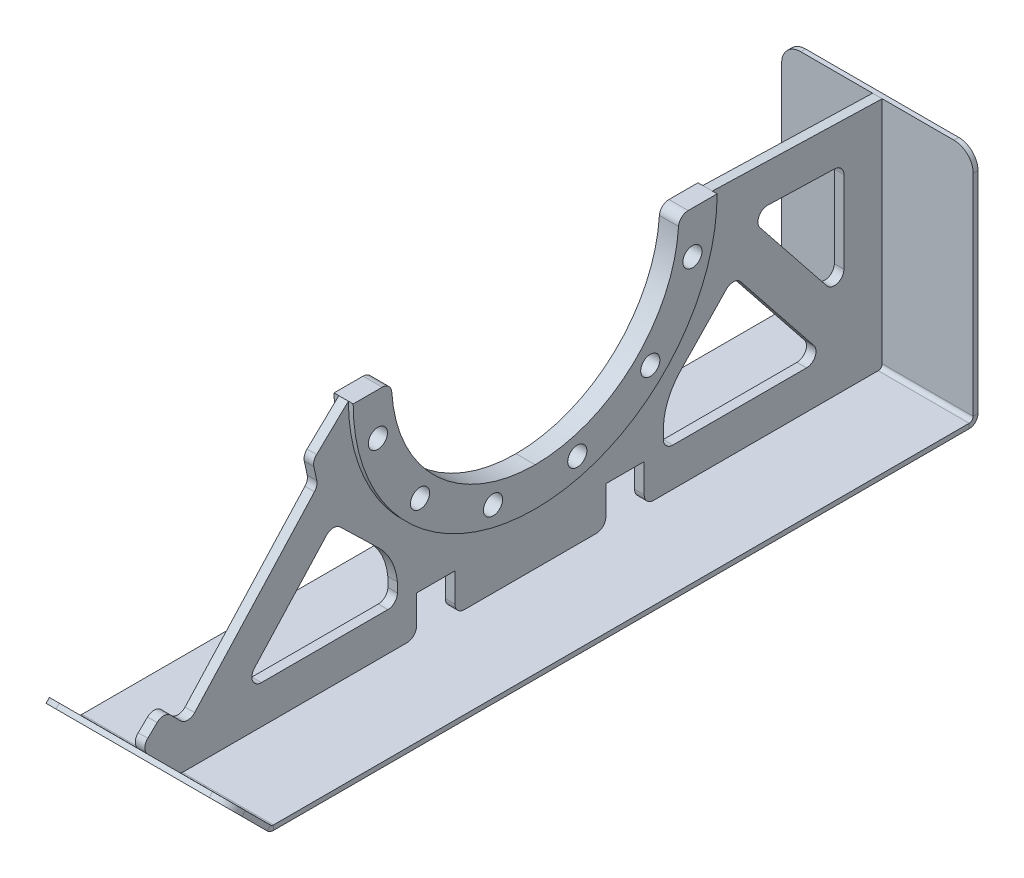
from build123d import *

# Parameters (mm, degrees)
FLANGE_PROFILE_DEPTH              = 12.7
F_7_8_1_DIAMETER_HOLE1_D          = 25.4
BOLT_PATTERN_COUNT                = 12
SKETCH5_W                         = 254
SKETCH5_H                         = 1317.865260112
BASE_SKID_DEPTH                   = 6.35
BEND_START                        = -127
BEND_HEEL_DEPTH                   = 254
BEND_HEEL_2_DEPTH                 = 254
BEND_TOE_DEPTH                    = 254
BEND_TOE_2_DEPTH                  = 254
WEBBING_BODY_DEPTH                = 6.35
WEBBING_HOLES_DEPTH               = 623.746559258
WEBBING_HOLES_DEPTH_BACK          = 623.746559258
CROSSBEAM_DEPTH                   = 623.746559258
CROSSBEAM_DEPTH_BACK              = 623.746559258
CROSSMEMBER_W                     = 50.8
CROSSMEMBER_H                     = 50.8
CROSSBEAM_CLEARANCE_DEPTH         = 6.35
CROSSBEAM_FILLET_R                = 12.7
FILLET_CLEARANCE_R                = 82.7
WEBBING_FILLET_R                  = 12.7
SKID_START                        = -474
SKID_EDGES_DEPTH                  = 8
SKID_START_2                      = -335
SKID_EDGES_2_DEPTH                = 8
FLANGE_FILLET_R                   = 12.7
CONVERT_START                     = -12.7
CONVERT_FLANGE_TO_SHEET_OUTLINE_R = 12.7
CONVERT_FLANGE_TO_SHEET_DEPTH     = 25.4
CONVERT_START_2                   = -6.35
CONVERT_WEBBING_TO_SHEET_DEPTH    = 12.7
FILLET2_R                         = 12.7


with BuildPart() as part:
    # Sketch1 → Flange Profile (new, symmetric)
    with BuildSketch(Plane(origin=(0, 0, 0), x_dir=(0, 0, -1), z_dir=(1, 0, 0))):
        with BuildLine():
            Line((241.3, 316.3), (190.5, 316.3))
            ThreePointArc((190.5, 316.3), (0, 125.8), (-190.5, 316.3))
            Line((-190.5, 316.3), (-241.3, 316.3))
            ThreePointArc((-241.3, 316.3), (0, 75), (241.3, 316.3))
        make_face()
    extrude(amount=FLANGE_PROFILE_DEPTH, both=True)

    # 7/8 (1) Diameter Hole1 (through all)
    with Locations(Plane(origin=(12.7, 260.420968162, -208.543385896), x_dir=(0, 0, 1), z_dir=(1, 0, 0))):
        with Locations((0, 0)):
            f_7_8_1_diameter_hole1 = Hole(F_7_8_1_DIAMETER_HOLE1_D / 2)

    # Bolt Pattern: 7/8 (1) Diameter Hole1 ×12 about axis
    bolt_pattern_axis = Axis((0, 316.3, 0), (1, 0, 0))
    for i in range(1, BOLT_PATTERN_COUNT):
        add(f_7_8_1_diameter_hole1.rotate(bolt_pattern_axis, i * 360 / BOLT_PATTERN_COUNT), mode=Mode.SUBTRACT)

    # Flange Fillet
    flange_fillet_edges = [part.edges().sort_by_distance(p)[0] for p in [
        (0, 316.3, 190.5),
        (0, 316.3, -190.5),
    ]]
    fillet(flange_fillet_edges, radius=FLANGE_FILLET_R)


with BuildPart() as body_2:
    # Base Skid: sheet metal written as solids
    # Sketch5 → Base Skid (new body)
    with BuildSketch(Plane(origin=(0, 0, 0), x_dir=(1, 0, 0), z_dir=(0, 1, 0))):
        with Locations((0, 118.6125)):
            Rectangle(SKETCH5_W, SKETCH5_H)
    extrude(amount=-BASE_SKID_DEPTH)

    # Bend Heel: read off the stored shape, not the designer's step
    # Bend Heel outline → Bend Heel (cut)
    with BuildSketch(Plane.YZ.offset(BEND_START)):
        with BuildLine():
            Line((0, -777.545130056), (0, -471.640528076))
            ThreePointArc((0, -471.640528076), (-4.636915504, -467.33583609), (-6.35, -461.245130056))
            Line((-6.35, -461.245130056), (-6.35, -777.545130056))
            Line((-6.35, -777.545130056), (0, -777.545130056))
        make_face()
    extrude(amount=BEND_HEEL_DEPTH, mode=Mode.SUBTRACT)

    # Bend Heel 2 outline → Bend Heel 2 (add)
    with BuildSketch(Plane.YZ.offset(BEND_START)):
        with BuildLine():
            Line((5.334, -472.929130056), (309.66453199, -472.929130056))
            Line((309.66453199, -472.929130056), (309.66453199, -466.579130056))
            Line((309.66453199, -466.579130056), (5.334, -466.579130056))
            ThreePointArc((5.334, -466.579130056), (1.56229243, -465.016837626), (0, -461.245130056))
            Line((0, -461.245130056), (0, -471.640528076))
            ThreePointArc((0, -471.640528076), (2.590277571, -472.602411563), (5.334, -472.929130056))
        make_face()
    extrude(amount=BEND_HEEL_2_DEPTH)

    # Bend Toe: read off the stored shape, not the designer's step
    # Bend Toe outline → Bend Toe (cut)
    with BuildSketch(Plane.YZ.offset(BEND_START)):
        with BuildLine():
            Line((-6.35, 540.320130056), (-6.35, 461.245130056))
            ThreePointArc((-6.35, 461.245130056), (-5.460608458, 465.71640328), (-2.927835631, 469.506965687))
            Line((-2.927835631, 469.506965687), (0, 472.434801318))
            Line((0, 472.434801318), (0, 540.320130056))
            Line((0, 540.320130056), (-6.35, 540.320130056))
        make_face()
    extrude(amount=BEND_TOE_DEPTH, mode=Mode.SUBTRACT)

    # Bend Toe 2 outline → Bend Toe 2 (add)
    with BuildSketch(Plane.YZ.offset(BEND_START)):
        with BuildLine():
            Line((48.754787092, 521.189588411), (0, 472.434801318))
            Line((0, 472.434801318), (0, 461.245130056))
            ThreePointArc((0, 461.245130056), (0.406026574, 463.286363484), (1.562292429, 465.016837626))
            Line((1.562292429, 465.016837626), (53.244915153, 516.69946035))
            Line((53.244915153, 516.69946035), (48.754787092, 521.189588411))
        make_face()
    extrude(amount=BEND_TOE_2_DEPTH)

    # Skid Edges: read off the stored shape, not the designer's step
    # Skid Edges outline → Skid Edges (cut)
    with BuildSketch(Plane.XY.offset(SKID_START)):
        with BuildLine():
            ThreePointArc((-127, 284.26453199), (-119.560512242, 302.225044232), (-101.6, 309.66453199))
            Line((-101.6, 309.66453199), (-127, 309.66453199))
            Line((-127, 309.66453199), (-127, 284.26453199))
        make_face()
        with BuildLine():
            ThreePointArc((101.6, 309.66453199), (119.560512242, 302.225044232), (127, 284.26453199))
            Line((127, 284.26453199), (127, 309.66453199))
            Line((127, 309.66453199), (101.6, 309.66453199))
        make_face()
    extrude(amount=SKID_EDGES_DEPTH, mode=Mode.SUBTRACT)

    # Skid Edges 2 outline → Skid Edges 2 (cut)
    with BuildSketch(Plane(origin=(0, 0, 0), x_dir=(1, 0, 0), z_dir=(0, 0.707106781186546, -0.707106781186549)).offset(SKID_START_2)):
        with BuildLine():
            Line((-127, -403.011532817), (-101.6, -403.011532817))
            ThreePointArc((-101.6, -403.011532817), (-119.560512242, -395.572045059), (-127, -377.611532817))
            Line((-127, -377.611532817), (-127, -403.011532817))
        make_face()
        with BuildLine():
            ThreePointArc((127, -377.611532817), (119.560512242, -395.572045059), (101.6, -403.011532817))
            Line((101.6, -403.011532817), (127, -403.011532817))
            Line((127, -403.011532817), (127, -377.611532817))
        make_face()
    extrude(amount=SKID_EDGES_2_DEPTH, mode=Mode.SUBTRACT)


with BuildPart() as body_3:
    # Sketch12 → Webbing Body (new, symmetric)
    with BuildSketch(Plane(origin=(0, 0, 0), x_dir=(0, 0, -1), z_dir=(1, 0, 0))):
        with BuildLine():
            Line((-516.69946035, 53.244915153), (-465.016837626, 1.562292429))
            ThreePointArc((-465.016837626, 1.562292429), (-463.286363484, 0.406026574), (-461.245130056, 0))
            Line((-461.245130056, 0), (461.245130056, 0))
            ThreePointArc((461.245130056, 0), (465.016837626, 1.562292429), (466.579130056, 5.334))
            Line((466.579130056, 5.334), (466.579130056, 309.66453199))
            Line((466.579130056, 309.66453199), (241.3, 316.3))
            ThreePointArc((241.3, 316.3), (0, 75), (-241.3, 316.3))
            Line((-241.3, 316.3), (-516.69946035, 53.244915153))
        make_face()
    extrude(amount=WEBBING_BODY_DEPTH, both=True)

    # Sketch13 → Webbing Holes (cut, two sides: drawn at the far end of the back side and taken through both)
    with BuildSketch(Plane(origin=(0, 0, 0), x_dir=(0, 0, -1), z_dir=(1, 0, 0)).offset(-WEBBING_HOLES_DEPTH_BACK)):
        Polygon((415.779130056, 260.338785622), (287.40157486, 264.120073132), (415.779130056, 103.103449381), align=None)
        Polygon((-121.787355666, 50.8), (-385.355758001, 50.8), (-261.612051176, 186.371001392), align=None)
        Polygon((269.894826504, 204.589693285), (392.510394874, 50.8), (121.787355666, 50.8), align=None)
        Polygon((-454.135463722, 50.8), (-485.950787611, 82.615323889), (-288.586784033, 271.132776469), (-281.840137894, 239.563133553), align=None)
    extrude(amount=WEBBING_HOLES_DEPTH + WEBBING_HOLES_DEPTH_BACK, mode=Mode.SUBTRACT)

    # crossmember → Crossbeam (cut, two sides: drawn at the far end of the back side and taken through both)
    with BuildSketch(Plane(origin=(0, 0, 0), x_dir=(0, 0, -1), z_dir=(1, 0, 0)).offset(-CROSSBEAM_DEPTH_BACK)):
        with Locations((125.5, 25.4)):
            Rectangle(CROSSMEMBER_W, CROSSMEMBER_H)
        with Locations((-125.5, 25.4)):
            Rectangle(CROSSMEMBER_W, CROSSMEMBER_H)
    extrude(amount=CROSSBEAM_DEPTH + CROSSBEAM_DEPTH_BACK, mode=Mode.SUBTRACT)

    # crossmember<5> → Crossbeam Clearance (add, symmetric)
    with BuildSketch(Plane(origin=(0, 0, 0), x_dir=(0, 0, -1), z_dir=(1, 0, 0))):
        Polygon((100.1, 50.8), (150.9, 50.8), (150.9, 0), (176.3, 0), (176.3, 76.2), (74.7, 76.2), (74.7, 0), (100.1, 0), align=None)
        Polygon((-100.1, 0), (-74.7, 0), (-74.7, 76.2), (-176.3, 76.2), (-176.3, 0), (-150.9, 0), (-150.9, 50.8), (-100.1, 50.8), align=None)
    extrude(amount=CROSSBEAM_CLEARANCE_DEPTH, both=True)

    # Crossbeam fillet
    crossbeam_fillet_edges = [body_3.edges().sort_by_distance(p)[0] for p in [
        (0, 0, -150.9),
        (0, 0, -100.1),
        (0, 0, 100.1),
        (0, 0, 150.9),
    ]]
    fillet(crossbeam_fillet_edges, radius=CROSSBEAM_FILLET_R)

    # Fillet Clearance
    # the kernel refuses this fillet: 82.7 mm, written as the material it adds along each edge
    with BuildSketch(Plane(origin=(6.35, 76.2, -146.248876324), x_dir=(0, 0, -1), z_dir=(-1, 0, 0))) as fillet_clearance_piece_1:
        with BuildLine():
            CenterArc((112.722573697, 2.172867127), FILLET_CLEARANCE_R, 181.505567644, 42.416154829)
            Line((53.154741922, -55.194052066), (0, 0))
            Line((0, 0), (30.051123676, 0))
        make_face()
    extrude(amount=12.7)
    with BuildSketch(Plane(origin=(-6.35, 76.2, 147.984309509), x_dir=(0, 0.6961019539421004, 0.7179429432190206), z_dir=(1, 0, 0))) as fillet_clearance_piece_2:
        with BuildLine():
            CenterArc((73.916608705, 82.7), FILLET_CLEARANCE_R, 229.610877342, 40.389122658)
            Line((20.32905017, 19.710607478), (0, 0))
            Line((0, 0), (73.916608705, 0))
        make_face()
    extrude(amount=12.7)

    # Webbing Fillet
    webbing_fillet_edges = [body_3.edges().sort_by_distance(p)[0] for p in [
        (0, 53.244915153, 516.69946035),
        (0, 82.615323889, 485.950787611),
        (0, 271.132776469, 288.586784033),
        (0, 239.563133553, 281.840137894),
        (0, 50.8, 454.135463722),
        (0, 204.589693285, -269.894826504),
        (0, 50.8, -392.510394874),
        (0, 186.371001392, 261.612051176),
        (0, 50.8, 385.355758001),
        (0, 260.338785622, -415.779130056),
        (0, 103.103449381, -415.779130056),
        (0, 264.120073132, -287.40157486),
    ]]
    fillet(webbing_fillet_edges, radius=WEBBING_FILLET_R)


with BuildPart() as body_4:
    # Convert Flange to Sheet: read off the stored shape, not the designer's step
    # Convert Flange to Sheet outline → Convert Flange to Sheet (new body)
    with BuildSketch(Plane.YZ.offset(CONVERT_START)):
        with BuildLine():
            ThreePointArc((304.39375, 190.127565626), (312.856636133, 194.107641068), (316.3, 202.802736668))
            Line((316.3, 202.802736668), (316.3, 241.3))
            ThreePointArc((316.3, 241.3), (75, 0), (316.3, -241.3))
            Line((316.3, -241.3), (316.3, -202.802736668))
            ThreePointArc((316.3, -202.802736668), (312.856636133, -194.107641068), (304.39375, -190.127565626))
            ThreePointArc((304.39375, -190.127565626), (125.8, 0), (304.39375, 190.127565626))
        make_face()
        with Locations((163.635645942, -152.664354058)):
            Circle(CONVERT_FLANGE_TO_SHEET_OUTLINE_R, mode=Mode.SUBTRACT)
        with Locations((107.756614104, -55.879031838)):
            Circle(CONVERT_FLANGE_TO_SHEET_OUTLINE_R, mode=Mode.SUBTRACT)
        with Locations((260.420968162, -208.543385896)):
            Circle(CONVERT_FLANGE_TO_SHEET_OUTLINE_R, mode=Mode.SUBTRACT)
        with Locations((107.756614104, 55.879031838)):
            Circle(CONVERT_FLANGE_TO_SHEET_OUTLINE_R, mode=Mode.SUBTRACT)
        with Locations((163.635645942, 152.664354058)):
            Circle(CONVERT_FLANGE_TO_SHEET_OUTLINE_R, mode=Mode.SUBTRACT)
        with Locations((260.420968162, 208.543385896)):
            Circle(CONVERT_FLANGE_TO_SHEET_OUTLINE_R, mode=Mode.SUBTRACT)
    extrude(amount=CONVERT_FLANGE_TO_SHEET_DEPTH)


with BuildPart() as body_5:
    # Convert Webbing to Sheet: read off the stored shape, not the designer's step
    # Convert Webbing to Sheet outline → Convert Webbing to Sheet (new body)
    with BuildSketch(Plane.YZ.offset(CONVERT_START_2)):
        with BuildLine():
            ThreePointArc((12.7, -150.9), (3.719743879, -154.619743879), (0, -163.6))
            Line((0, -163.6), (0, -461.245130056))
            ThreePointArc((0, -461.245130056), (1.56229243, -465.016837626), (5.334, -466.579130056))
            Line((5.334, -466.579130056), (309.66453199, -466.579130056))
            Line((309.66453199, -466.579130056), (316.3, -241.3))
            ThreePointArc((316.3, -241.3), (75, 0), (316.3, 241.3))
            Line((316.3, 241.3), (276.032946761, 283.456663644))
            ThreePointArc((276.032946761, 283.456663644), (270.588863094, 286.821521817), (264.195081913, 287.104151799))
            Line((264.195081913, 287.104151799), (245.952992349, 283.205693921))
            ThreePointArc((245.952992349, 283.205693921), (239.977011634, 283.367384751), (234.737080357, 286.245163347))
            Line((234.737080357, 286.245163347), (60.617668132, 445.174294781))
            ThreePointArc((60.617668132, 445.174294781), (56.482733464, 454.264990592), (60.199179654, 463.534643376))
            Line((60.199179654, 463.534643376), (73.838585609, 477.174049331))
            ThreePointArc((73.838585609, 477.174049331), (77.557495428, 486.008756787), (74.042049988, 494.926379196))
            Line((74.042049988, 494.926379196), (62.220398575, 507.302784775))
            ThreePointArc((62.220398575, 507.302784775), (53.18222674, 511.229876971), (44.056421954, 507.510967151))
            Line((44.056421954, 507.510967151), (1.562292429, 465.016837626))
            ThreePointArc((1.562292429, 465.016837626), (0.406026574, 463.286363484), (0, 461.245130056))
            Line((0, 461.245130056), (0, 163.6))
            ThreePointArc((0, 163.6), (3.719743879, 154.619743879), (12.7, 150.9))
            Line((12.7, 150.9), (50.8, 150.9))
            Line((50.8, 150.9), (50.8, 100.1))
            Line((50.8, 100.1), (12.7, 100.1))
            ThreePointArc((12.7, 100.1), (3.719743879, 96.380256121), (0, 87.4))
            Line((0, 87.4), (0, -87.4))
            ThreePointArc((0, -87.4), (3.719743879, -96.380256121), (12.7, -100.1))
            Line((12.7, -100.1), (50.8, -100.1))
            Line((50.8, -100.1), (50.8, -150.9))
            Line((50.8, -150.9), (12.7, -150.9))
        make_face()
        with BuildLine():
            Line((131.394052066, -199.403618246), (194.156373438, -259.846997017))
            ThreePointArc((194.156373438, -259.846997017), (198.032828609, -269.588102319), (193.263931773, -278.924785894))
            Line((193.263931773, -278.924785894), (71.417230327, -376.07240504))
            ThreePointArc((71.417230327, -376.07240504), (57.98904841, -377.584278062), (50.8, -366.142275939))
            Line((50.8, -366.142275939), (50.8, -176.3))
            Line((50.8, -176.3), (76.2, -176.3))
            ThreePointArc((76.2, -176.3), (105.959731151, -182.685152645), (131.394052066, -199.403618246))
        make_face(mode=Mode.SUBTRACT)
        with BuildLine():
            Line((248.00734903, -415.779130056), (139.404356101, -415.779130056))
            ThreePointArc((139.404356101, -415.779130056), (127.41680757, -407.273016107), (131.487125774, -393.149000955))
            Line((131.487125774, -393.149000955), (242.701867121, -304.478177637))
            ThreePointArc((242.701867121, -304.478177637), (256.297905781, -303.048679283), (263.313592002, -314.782215819))
            Line((263.313592002, -314.782215819), (260.701843584, -403.453039137))
            ThreePointArc((260.701843584, -403.453039137), (256.854420711, -412.190624042), (248.00734903, -415.779130056))
        make_face(mode=Mode.SUBTRACT)
        with BuildLine():
            Line((177.260013842, 252.215196046), (127.653495748, 201.052217116))
            ThreePointArc((127.653495748, 201.052217116), (104.130662555, 184.094736548), (76.2, 176.3))
            Line((76.2, 176.3), (50.8, 176.3))
            Line((50.8, 176.3), (50.8, 356.568787103))
            ThreePointArc((50.8, 356.568787103), (58.373814726, 368.18826319), (72.061767643, 365.948879577))
            Line((72.061767643, 365.948879577), (176.703906107, 270.435783335))
            ThreePointArc((176.703906107, 270.435783335), (180.836227428, 261.443125193), (177.260013842, 252.215196046))
        make_face(mode=Mode.SUBTRACT)
    extrude(amount=CONVERT_WEBBING_TO_SHEET_DEPTH)

    # Fillet2
    fillet2_edges = [body_5.edges().sort_by_distance(p)[0] for p in [
        (0, 50.8, 176.3),
        (0, 50.8, -176.3),
    ]]
    fillet(fillet2_edges, radius=FILLET2_R)


solid = Compound([body_2.part, body_4.part, body_5.part])
